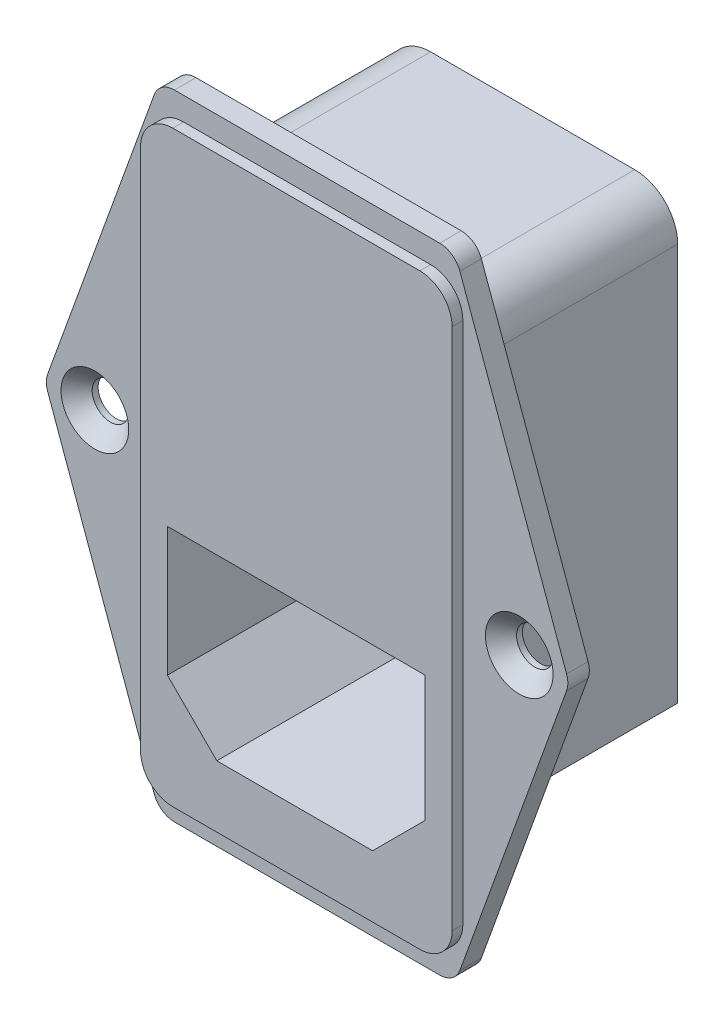
from build123d import *

# Parameters (mm, degrees)
BOSS_EXTRUDE1_DEPTH                            = 2
SKETCH2_W                                      = 29
SKETCH2_H                                      = 54.7
BOSS_EXTRUDE2_DEPTH                            = 1
FILLET1_R                                      = 3
FILLET2_R                                      = 2
CSK_FOR_M3_FLAT_HEAD_MACHINE_SCREW1_AT_2_COUNT = 2
CSK_FOR_M3_FLAT_HEAD_MACHINE_SCREW1_AT_2_PITCH = 39.5
SKETCH5_W                                      = 27
SKETCH5_H                                      = 47
BOSS_EXTRUDE3_DEPTH                            = 19
CHAMFER1_SIZE                                  = 6
FILLET3_R                                      = 4
CUT_EXTRUDE1_DEPTH                             = 17


with BuildPart() as part:
    # Sketch1 → Boss-Extrude1 (new body)
    with BuildSketch(Plane.XY):
        Polygon((-13.75, 29.5), (-24.4, 0), (-13.75, -29.5), (13.75, -29.5), (24.4, 0), (13.75, 29.5), align=None)
    extrude(amount=BOSS_EXTRUDE1_DEPTH)

    # Sketch2 → Boss-Extrude2 (add)
    with BuildSketch(Plane.XY.offset(2)):
        Rectangle(SKETCH2_W, SKETCH2_H)
    extrude(amount=BOSS_EXTRUDE2_DEPTH)

    # Fillet1
    fillet1_edges = [part.edges().sort_by_distance(p)[0] for p in [
        (14.5, -27.35, 2.5),
        (-14.5, -27.35, 2.5),
        (14.5, 27.35, 2.5),
        (-14.5, 27.35, 2.5),
    ]]
    fillet(fillet1_edges, radius=FILLET1_R)

    # Fillet2
    fillet2_edges = [part.edges().sort_by_distance(p)[0] for p in [
        (-13.75, 29.5, 1),
        (13.75, 29.5, 1),
        (24.4, 0, 1),
        (-24.4, 0, 1),
        (13.75, -29.5, 1),
        (-13.75, -29.5, 1),
    ]]
    fillet(fillet2_edges, radius=FILLET2_R)

    # Sketch3 → CSK for M3 Flat Head Machine Screw1 (revolve, cut)
    with BuildSketch(Plane(origin=(-19.75, 0, 2), x_dir=(0, -1, 0), z_dir=(1, 0, 0))):
        Polygon((0, 0), (0, 2), (1.7, 2), (1.7, 1.45), (3.15, 0), align=None)
    csk_for_m3_flat_head_machine_screw1 = revolve(axis=Axis((-19.75, 0, 8.35), (0, 0, -1)), mode=Mode.SUBTRACT)

    # CSK for M3 Flat Head Machine Screw1 at 2: CSK for M3 Flat Head Machine Screw1 ×2
    with Locations(*[(i * CSK_FOR_M3_FLAT_HEAD_MACHINE_SCREW1_AT_2_PITCH, 0, 0) for i in range(1, CSK_FOR_M3_FLAT_HEAD_MACHINE_SCREW1_AT_2_COUNT)]):
        add(csk_for_m3_flat_head_machine_screw1, mode=Mode.SUBTRACT)

    # Sketch5 → Boss-Extrude3 (add)
    with BuildSketch(Plane(origin=(0, 0, 0), x_dir=(-1, 0, 0), z_dir=(0, 0, -1))):
        Rectangle(SKETCH5_W, SKETCH5_H)
    extrude(amount=BOSS_EXTRUDE3_DEPTH)

    # Chamfer1
    chamfer1_edges = [part.edges().sort_by_distance(p)[0] for p in [
        (-13.5, -23.5, -9.5),
        (13.5, -23.5, -9.5),
    ]]
    chamfer(chamfer1_edges, length=CHAMFER1_SIZE)

    # Fillet3
    fillet3_edges = [part.edges().sort_by_distance(p)[0] for p in [
        (-13.5, 23.5, -9.5),
        (13.5, 23.5, -9.5),
    ]]
    fillet(fillet3_edges, radius=FILLET3_R)

    # Sketch6 → Cut-Extrude1 (cut)
    with BuildSketch(Plane.XY.offset(3)):
        Polygon((-12, -5), (12, -5), (12, -16.7), (7.1, -21.6), (-7.4, -21.6), (-12, -17), align=None)
    extrude(amount=-CUT_EXTRUDE1_DEPTH, mode=Mode.SUBTRACT)


solid = part.part
